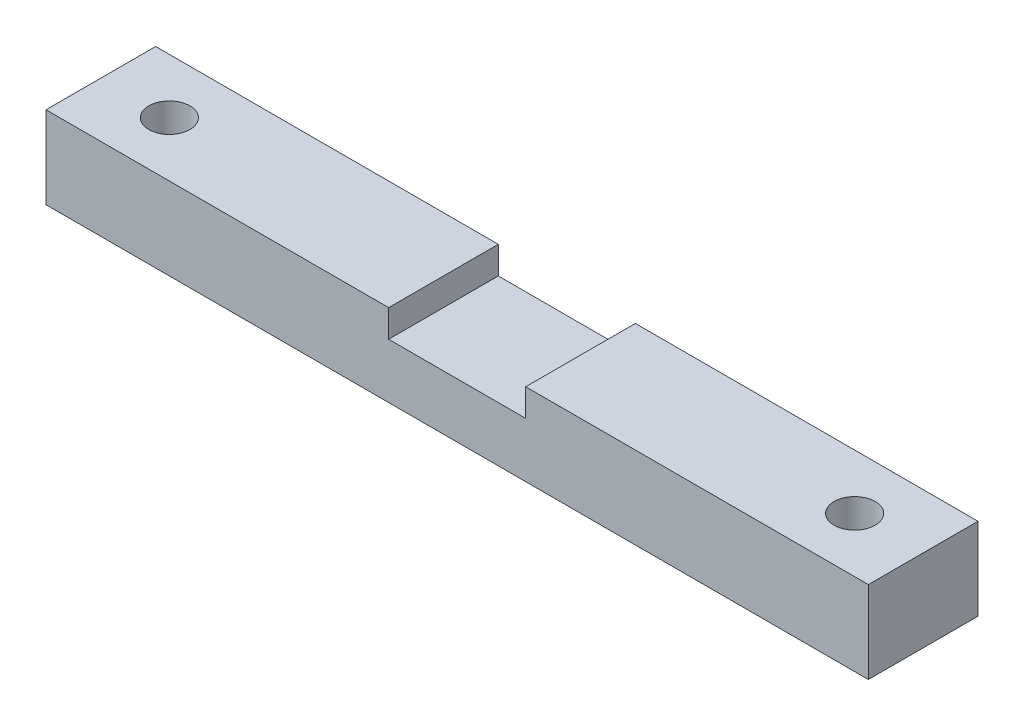
from build123d import *

# Parameters (mm, degrees)
SKETCH1_W           = 60
SKETCH1_H           = 8
BOSS_EXTRUDE1_DEPTH = 6
SKETCH2_W           = 10
SKETCH2_H           = 2
CUT_EXTRUDE1_DEPTH  = 32.622776602
SKETCH3_R           = 1.5
CUT_EXTRUDE2_DEPTH  = 31.854497241


with BuildPart() as part:
    # Sketch1 → Boss-Extrude1 (new body)
    with BuildSketch(Plane(origin=(0, 0, 0), x_dir=(1, 0, 0), z_dir=(0, 1, 0))):
        Rectangle(SKETCH1_W, SKETCH1_H)
    extrude(amount=BOSS_EXTRUDE1_DEPTH)

    # Sketch2 → Cut-Extrude1 (cut, through all)
    with BuildSketch(Plane.XY.offset(4)):
        with Locations((0, 5)):
            Rectangle(SKETCH2_W, SKETCH2_H)
    extrude(amount=-CUT_EXTRUDE1_DEPTH, mode=Mode.SUBTRACT)

    # Sketch3 → Cut-Extrude2 (cut, through all)
    with BuildSketch(Plane(origin=(0, 6, 0), x_dir=(1, 0, 0), z_dir=(0, 1, 0))):
        with Locations((-25, 0)):
            Circle(SKETCH3_R)
        with Locations((25, 0)):
            Circle(SKETCH3_R)
    extrude(amount=-CUT_EXTRUDE2_DEPTH, mode=Mode.SUBTRACT)


solid = part.part
